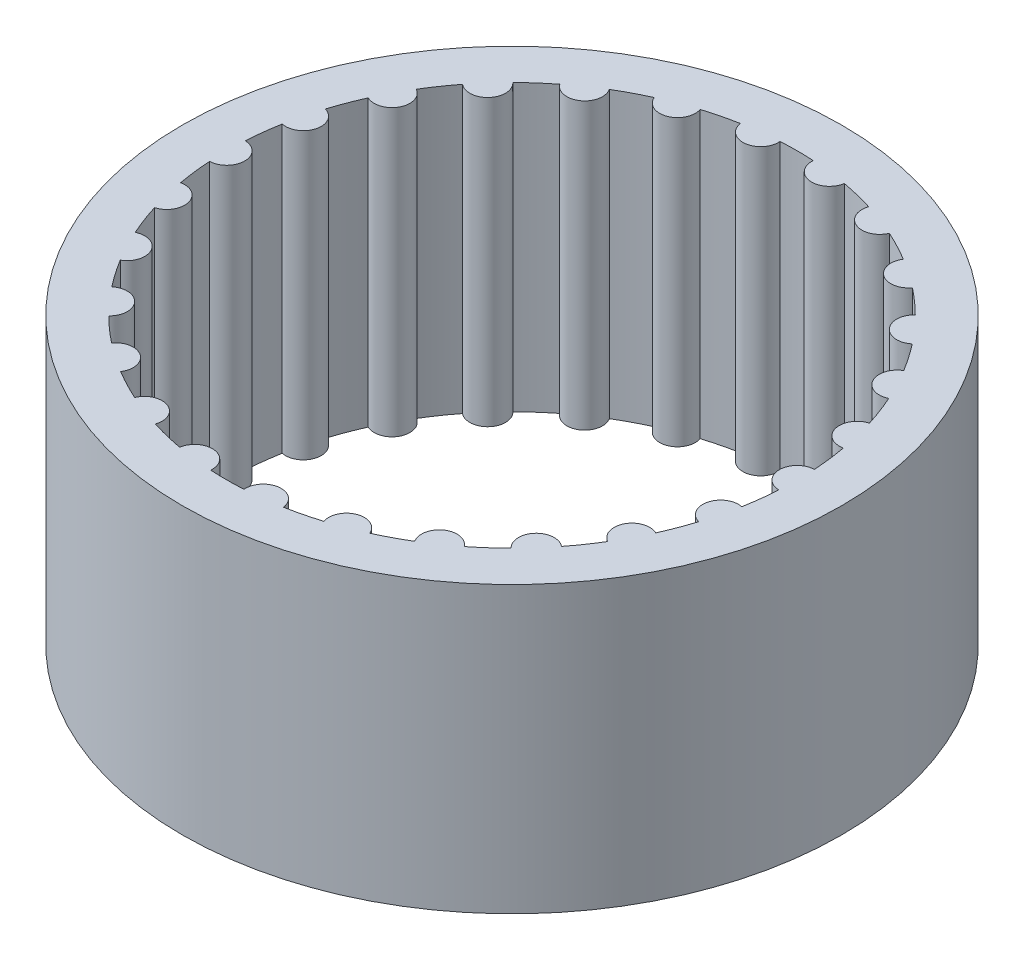
from build123d import *

# Parameters (mm, degrees)
BOSS_EXTRUDE1_DEPTH         = 8
BOSS_EXTRUDE1_DEPTH_BACK    = 8
SKETCH2_R                   = 1
BOSS_EXTRUDE1_2_DEPTH       = 8
BOSS_EXTRUDE1_2_DEPTH_BACK  = 8
BOSS_EXTRUDE1_3_DEPTH       = 8
BOSS_EXTRUDE1_3_DEPTH_BACK  = 8
BOSS_EXTRUDE1_4_DEPTH       = 8
BOSS_EXTRUDE1_4_DEPTH_BACK  = 8
BOSS_EXTRUDE1_5_DEPTH       = 8
BOSS_EXTRUDE1_5_DEPTH_BACK  = 8
BOSS_EXTRUDE1_6_DEPTH       = 8
BOSS_EXTRUDE1_6_DEPTH_BACK  = 8
BOSS_EXTRUDE1_7_DEPTH       = 8
BOSS_EXTRUDE1_7_DEPTH_BACK  = 8
BOSS_EXTRUDE1_8_DEPTH       = 8
BOSS_EXTRUDE1_8_DEPTH_BACK  = 8
BOSS_EXTRUDE1_9_DEPTH       = 8
BOSS_EXTRUDE1_9_DEPTH_BACK  = 8
BOSS_EXTRUDE1_10_DEPTH      = 8
BOSS_EXTRUDE1_10_DEPTH_BACK = 8
BOSS_EXTRUDE1_11_DEPTH      = 8
BOSS_EXTRUDE1_11_DEPTH_BACK = 8
BOSS_EXTRUDE1_12_DEPTH      = 8
BOSS_EXTRUDE1_12_DEPTH_BACK = 8
BOSS_EXTRUDE1_13_DEPTH      = 8
BOSS_EXTRUDE1_13_DEPTH_BACK = 8
BOSS_EXTRUDE1_14_DEPTH      = 8
BOSS_EXTRUDE1_14_DEPTH_BACK = 8
BOSS_EXTRUDE1_15_DEPTH      = 8
BOSS_EXTRUDE1_15_DEPTH_BACK = 8
BOSS_EXTRUDE1_16_DEPTH      = 8
BOSS_EXTRUDE1_16_DEPTH_BACK = 8
BOSS_EXTRUDE1_17_DEPTH      = 8
BOSS_EXTRUDE1_17_DEPTH_BACK = 8
BOSS_EXTRUDE1_18_DEPTH      = 8
BOSS_EXTRUDE1_18_DEPTH_BACK = 8
BOSS_EXTRUDE1_19_DEPTH      = 8
BOSS_EXTRUDE1_19_DEPTH_BACK = 8
BOSS_EXTRUDE1_20_DEPTH      = 8
BOSS_EXTRUDE1_20_DEPTH_BACK = 8
BOSS_EXTRUDE1_21_DEPTH      = 8
BOSS_EXTRUDE1_21_DEPTH_BACK = 8
BOSS_EXTRUDE1_22_DEPTH      = 8
BOSS_EXTRUDE1_22_DEPTH_BACK = 8
BOSS_EXTRUDE1_23_DEPTH      = 8
BOSS_EXTRUDE1_23_DEPTH_BACK = 8
BOSS_EXTRUDE1_24_DEPTH      = 8
BOSS_EXTRUDE1_24_DEPTH_BACK = 8
BOSS_EXTRUDE1_25_DEPTH      = 8
BOSS_EXTRUDE1_25_DEPTH_BACK = 8
BOSS_EXTRUDE1_26_DEPTH      = 8
BOSS_EXTRUDE1_26_DEPTH_BACK = 8
BOSS_EXTRUDE3_DEPTH         = 8
BOSS_EXTRUDE3_DEPTH_BACK    = 8
SKETCH5_R                   = 18.5
SKETCH5_R_2                 = 16


with BuildPart() as part:
    # Sketch2 → Boss-Extrude1 (new, two sides: drawn at the far end of the back side and taken through both)
    with BuildSketch(Plane(origin=(0, 0, 0), x_dir=(1, 0, 0), z_dir=(0, 1, 0)).offset(-BOSS_EXTRUDE1_DEPTH_BACK)):
        with Locations((15.5, 0)):
            Circle(SKETCH2_R)
    extrude(amount=BOSS_EXTRUDE1_DEPTH + BOSS_EXTRUDE1_DEPTH_BACK)



with BuildPart() as body_2:
    # Sketch2 → Boss-Extrude1 2 (new, two sides: drawn at the far end of the back side and taken through both)
    with BuildSketch(Plane(origin=(0, 0, 0), x_dir=(1, 0, 0), z_dir=(0, 1, 0)).offset(-BOSS_EXTRUDE1_2_DEPTH_BACK)):
        with Locations((15.035069079, -3.829050629)):
            Circle(SKETCH2_R)
    extrude(amount=BOSS_EXTRUDE1_2_DEPTH + BOSS_EXTRUDE1_2_DEPTH_BACK)


with BuildPart() as body_3:
    # Sketch2 → Boss-Extrude1 3 (new, two sides: drawn at the far end of the back side and taken through both)
    with BuildSketch(Plane(origin=(0, 0, 0), x_dir=(1, 0, 0), z_dir=(0, 1, 0)).offset(-BOSS_EXTRUDE1_3_DEPTH_BACK)):
        with Locations((13.66729641, -7.435570753)):
            Circle(SKETCH2_R)
    extrude(amount=BOSS_EXTRUDE1_3_DEPTH + BOSS_EXTRUDE1_3_DEPTH_BACK)


with BuildPart() as body_4:
    # Sketch2 → Boss-Extrude1 4 (new, two sides: drawn at the far end of the back side and taken through both)
    with BuildSketch(Plane(origin=(0, 0, 0), x_dir=(1, 0, 0), z_dir=(0, 1, 0)).offset(-BOSS_EXTRUDE1_4_DEPTH_BACK)):
        with Locations((11.476171971, -10.609962532)):
            Circle(SKETCH2_R)
    extrude(amount=BOSS_EXTRUDE1_4_DEPTH + BOSS_EXTRUDE1_4_DEPTH_BACK)


with BuildPart() as body_5:
    # Sketch2 → Boss-Extrude1 5 (new, two sides: drawn at the far end of the back side and taken through both)
    with BuildSketch(Plane(origin=(0, 0, 0), x_dir=(1, 0, 0), z_dir=(0, 1, 0)).offset(-BOSS_EXTRUDE1_5_DEPTH_BACK)):
        with Locations((8.589035948, -13.167741854)):
            Circle(SKETCH2_R)
    extrude(amount=BOSS_EXTRUDE1_5_DEPTH + BOSS_EXTRUDE1_5_DEPTH_BACK)


with BuildPart() as body_6:
    # Sketch2 → Boss-Extrude1 6 (new, two sides: drawn at the far end of the back side and taken through both)
    with BuildSketch(Plane(origin=(0, 0, 0), x_dir=(1, 0, 0), z_dir=(0, 1, 0)).offset(-BOSS_EXTRUDE1_6_DEPTH_BACK)):
        with Locations((5.173678193, -14.960259883)):
            Circle(SKETCH2_R)
    extrude(amount=BOSS_EXTRUDE1_6_DEPTH + BOSS_EXTRUDE1_6_DEPTH_BACK)


with BuildPart() as body_7:
    # Sketch2 → Boss-Extrude1 7 (new, two sides: drawn at the far end of the back side and taken through both)
    with BuildSketch(Plane(origin=(0, 0, 0), x_dir=(1, 0, 0), z_dir=(0, 1, 0)).offset(-BOSS_EXTRUDE1_7_DEPTH_BACK)):
        with Locations((1.428586884, -15.883341986)):
            Circle(SKETCH2_R)
    extrude(amount=BOSS_EXTRUDE1_7_DEPTH + BOSS_EXTRUDE1_7_DEPTH_BACK)


with BuildPart() as body_8:
    # Sketch2 → Boss-Extrude1 8 (new, two sides: drawn at the far end of the back side and taken through both)
    with BuildSketch(Plane(origin=(0, 0, 0), x_dir=(1, 0, 0), z_dir=(0, 1, 0)).offset(-BOSS_EXTRUDE1_8_DEPTH_BACK)):
        with Locations((-2.428586884, -15.883341986)):
            Circle(SKETCH2_R)
    extrude(amount=BOSS_EXTRUDE1_8_DEPTH + BOSS_EXTRUDE1_8_DEPTH_BACK)


with BuildPart() as body_9:
    # Sketch2 → Boss-Extrude1 9 (new, two sides: drawn at the far end of the back side and taken through both)
    with BuildSketch(Plane(origin=(0, 0, 0), x_dir=(1, 0, 0), z_dir=(0, 1, 0)).offset(-BOSS_EXTRUDE1_9_DEPTH_BACK)):
        with Locations((-6.173678193, -14.960259883)):
            Circle(SKETCH2_R)
    extrude(amount=BOSS_EXTRUDE1_9_DEPTH + BOSS_EXTRUDE1_9_DEPTH_BACK)


with BuildPart() as body_10:
    # Sketch2 → Boss-Extrude1 10 (new, two sides: drawn at the far end of the back side and taken through both)
    with BuildSketch(Plane(origin=(0, 0, 0), x_dir=(1, 0, 0), z_dir=(0, 1, 0)).offset(-BOSS_EXTRUDE1_10_DEPTH_BACK)):
        with Locations((-9.589035948, -13.167741854)):
            Circle(SKETCH2_R)
    extrude(amount=BOSS_EXTRUDE1_10_DEPTH + BOSS_EXTRUDE1_10_DEPTH_BACK)


with BuildPart() as body_11:
    # Sketch2 → Boss-Extrude1 11 (new, two sides: drawn at the far end of the back side and taken through both)
    with BuildSketch(Plane(origin=(0, 0, 0), x_dir=(1, 0, 0), z_dir=(0, 1, 0)).offset(-BOSS_EXTRUDE1_11_DEPTH_BACK)):
        with Locations((-12.476171971, -10.609962532)):
            Circle(SKETCH2_R)
    extrude(amount=BOSS_EXTRUDE1_11_DEPTH + BOSS_EXTRUDE1_11_DEPTH_BACK)


with BuildPart() as body_12:
    # Sketch2 → Boss-Extrude1 12 (new, two sides: drawn at the far end of the back side and taken through both)
    with BuildSketch(Plane(origin=(0, 0, 0), x_dir=(1, 0, 0), z_dir=(0, 1, 0)).offset(-BOSS_EXTRUDE1_12_DEPTH_BACK)):
        with Locations((-14.66729641, -7.435570753)):
            Circle(SKETCH2_R)
    extrude(amount=BOSS_EXTRUDE1_12_DEPTH + BOSS_EXTRUDE1_12_DEPTH_BACK)


with BuildPart() as body_13:
    # Sketch2 → Boss-Extrude1 13 (new, two sides: drawn at the far end of the back side and taken through both)
    with BuildSketch(Plane(origin=(0, 0, 0), x_dir=(1, 0, 0), z_dir=(0, 1, 0)).offset(-BOSS_EXTRUDE1_13_DEPTH_BACK)):
        with Locations((-16.035069079, -3.829050629)):
            Circle(SKETCH2_R)
    extrude(amount=BOSS_EXTRUDE1_13_DEPTH + BOSS_EXTRUDE1_13_DEPTH_BACK)


with BuildPart() as body_14:
    # Sketch2 → Boss-Extrude1 14 (new, two sides: drawn at the far end of the back side and taken through both)
    with BuildSketch(Plane(origin=(0, 0, 0), x_dir=(1, 0, 0), z_dir=(0, 1, 0)).offset(-BOSS_EXTRUDE1_14_DEPTH_BACK)):
        with Locations((-16.5, 0)):
            Circle(SKETCH2_R)
    extrude(amount=BOSS_EXTRUDE1_14_DEPTH + BOSS_EXTRUDE1_14_DEPTH_BACK)


with BuildPart() as body_15:
    # Sketch2 → Boss-Extrude1 15 (new, two sides: drawn at the far end of the back side and taken through both)
    with BuildSketch(Plane(origin=(0, 0, 0), x_dir=(1, 0, 0), z_dir=(0, 1, 0)).offset(-BOSS_EXTRUDE1_15_DEPTH_BACK)):
        with Locations((-16.035069079, 3.829050629)):
            Circle(SKETCH2_R)
    extrude(amount=BOSS_EXTRUDE1_15_DEPTH + BOSS_EXTRUDE1_15_DEPTH_BACK)


with BuildPart() as body_16:
    # Sketch2 → Boss-Extrude1 16 (new, two sides: drawn at the far end of the back side and taken through both)
    with BuildSketch(Plane(origin=(0, 0, 0), x_dir=(1, 0, 0), z_dir=(0, 1, 0)).offset(-BOSS_EXTRUDE1_16_DEPTH_BACK)):
        with Locations((-14.66729641, 7.435570753)):
            Circle(SKETCH2_R)
    extrude(amount=BOSS_EXTRUDE1_16_DEPTH + BOSS_EXTRUDE1_16_DEPTH_BACK)


with BuildPart() as body_17:
    # Sketch2 → Boss-Extrude1 17 (new, two sides: drawn at the far end of the back side and taken through both)
    with BuildSketch(Plane(origin=(0, 0, 0), x_dir=(1, 0, 0), z_dir=(0, 1, 0)).offset(-BOSS_EXTRUDE1_17_DEPTH_BACK)):
        with Locations((-12.476171971, 10.609962532)):
            Circle(SKETCH2_R)
    extrude(amount=BOSS_EXTRUDE1_17_DEPTH + BOSS_EXTRUDE1_17_DEPTH_BACK)


with BuildPart() as body_18:
    # Sketch2 → Boss-Extrude1 18 (new, two sides: drawn at the far end of the back side and taken through both)
    with BuildSketch(Plane(origin=(0, 0, 0), x_dir=(1, 0, 0), z_dir=(0, 1, 0)).offset(-BOSS_EXTRUDE1_18_DEPTH_BACK)):
        with Locations((-9.589035948, 13.167741854)):
            Circle(SKETCH2_R)
    extrude(amount=BOSS_EXTRUDE1_18_DEPTH + BOSS_EXTRUDE1_18_DEPTH_BACK)


with BuildPart() as body_19:
    # Sketch2 → Boss-Extrude1 19 (new, two sides: drawn at the far end of the back side and taken through both)
    with BuildSketch(Plane(origin=(0, 0, 0), x_dir=(1, 0, 0), z_dir=(0, 1, 0)).offset(-BOSS_EXTRUDE1_19_DEPTH_BACK)):
        with Locations((-6.173678193, 14.960259883)):
            Circle(SKETCH2_R)
    extrude(amount=BOSS_EXTRUDE1_19_DEPTH + BOSS_EXTRUDE1_19_DEPTH_BACK)


with BuildPart() as body_20:
    # Sketch2 → Boss-Extrude1 20 (new, two sides: drawn at the far end of the back side and taken through both)
    with BuildSketch(Plane(origin=(0, 0, 0), x_dir=(1, 0, 0), z_dir=(0, 1, 0)).offset(-BOSS_EXTRUDE1_20_DEPTH_BACK)):
        with Locations((-2.428586884, 15.883341986)):
            Circle(SKETCH2_R)
    extrude(amount=BOSS_EXTRUDE1_20_DEPTH + BOSS_EXTRUDE1_20_DEPTH_BACK)


with BuildPart() as body_21:
    # Sketch2 → Boss-Extrude1 21 (new, two sides: drawn at the far end of the back side and taken through both)
    with BuildSketch(Plane(origin=(0, 0, 0), x_dir=(1, 0, 0), z_dir=(0, 1, 0)).offset(-BOSS_EXTRUDE1_21_DEPTH_BACK)):
        with Locations((1.428586884, 15.883341986)):
            Circle(SKETCH2_R)
    extrude(amount=BOSS_EXTRUDE1_21_DEPTH + BOSS_EXTRUDE1_21_DEPTH_BACK)


with BuildPart() as body_22:
    # Sketch2 → Boss-Extrude1 22 (new, two sides: drawn at the far end of the back side and taken through both)
    with BuildSketch(Plane(origin=(0, 0, 0), x_dir=(1, 0, 0), z_dir=(0, 1, 0)).offset(-BOSS_EXTRUDE1_22_DEPTH_BACK)):
        with Locations((5.173678193, 14.960259883)):
            Circle(SKETCH2_R)
    extrude(amount=BOSS_EXTRUDE1_22_DEPTH + BOSS_EXTRUDE1_22_DEPTH_BACK)


with BuildPart() as body_23:
    # Sketch2 → Boss-Extrude1 23 (new, two sides: drawn at the far end of the back side and taken through both)
    with BuildSketch(Plane(origin=(0, 0, 0), x_dir=(1, 0, 0), z_dir=(0, 1, 0)).offset(-BOSS_EXTRUDE1_23_DEPTH_BACK)):
        with Locations((8.589035948, 13.167741854)):
            Circle(SKETCH2_R)
    extrude(amount=BOSS_EXTRUDE1_23_DEPTH + BOSS_EXTRUDE1_23_DEPTH_BACK)


with BuildPart() as body_24:
    # Sketch2 → Boss-Extrude1 24 (new, two sides: drawn at the far end of the back side and taken through both)
    with BuildSketch(Plane(origin=(0, 0, 0), x_dir=(1, 0, 0), z_dir=(0, 1, 0)).offset(-BOSS_EXTRUDE1_24_DEPTH_BACK)):
        with Locations((11.476171971, 10.609962532)):
            Circle(SKETCH2_R)
    extrude(amount=BOSS_EXTRUDE1_24_DEPTH + BOSS_EXTRUDE1_24_DEPTH_BACK)


with BuildPart() as body_25:
    # Sketch2 → Boss-Extrude1 25 (new, two sides: drawn at the far end of the back side and taken through both)
    with BuildSketch(Plane(origin=(0, 0, 0), x_dir=(1, 0, 0), z_dir=(0, 1, 0)).offset(-BOSS_EXTRUDE1_25_DEPTH_BACK)):
        with Locations((13.66729641, 7.435570753)):
            Circle(SKETCH2_R)
    extrude(amount=BOSS_EXTRUDE1_25_DEPTH + BOSS_EXTRUDE1_25_DEPTH_BACK)


with BuildPart() as body_26:
    # Sketch2 → Boss-Extrude1 26 (new, two sides: drawn at the far end of the back side and taken through both)
    with BuildSketch(Plane(origin=(0, 0, 0), x_dir=(1, 0, 0), z_dir=(0, 1, 0)).offset(-BOSS_EXTRUDE1_26_DEPTH_BACK)):
        with Locations((15.035069079, 3.829050629)):
            Circle(SKETCH2_R)
    extrude(amount=BOSS_EXTRUDE1_26_DEPTH + BOSS_EXTRUDE1_26_DEPTH_BACK)


with BuildPart() as part_1:
    add(part.part)

    add(body_2.part)  # Boss-Extrude3 merges body 2

    add(body_3.part)  # Boss-Extrude3 merges body 3

    add(body_4.part)  # Boss-Extrude3 merges body 4

    add(body_5.part)  # Boss-Extrude3 merges body 5

    add(body_6.part)  # Boss-Extrude3 merges body 6

    add(body_7.part)  # Boss-Extrude3 merges body 7

    add(body_8.part)  # Boss-Extrude3 merges body 8

    add(body_9.part)  # Boss-Extrude3 merges body 9

    add(body_10.part)  # Boss-Extrude3 merges body 10

    add(body_11.part)  # Boss-Extrude3 merges body 11

    add(body_12.part)  # Boss-Extrude3 merges body 12

    add(body_13.part)  # Boss-Extrude3 merges body 13

    add(body_14.part)  # Boss-Extrude3 merges body 14

    add(body_15.part)  # Boss-Extrude3 merges body 15

    add(body_16.part)  # Boss-Extrude3 merges body 16

    add(body_17.part)  # Boss-Extrude3 merges body 17

    add(body_18.part)  # Boss-Extrude3 merges body 18

    add(body_19.part)  # Boss-Extrude3 merges body 19

    add(body_20.part)  # Boss-Extrude3 merges body 20

    add(body_21.part)  # Boss-Extrude3 merges body 21

    add(body_22.part)  # Boss-Extrude3 merges body 22

    add(body_23.part)  # Boss-Extrude3 merges body 23

    add(body_24.part)  # Boss-Extrude3 merges body 24

    add(body_25.part)  # Boss-Extrude3 merges body 25

    add(body_26.part)  # Boss-Extrude3 merges body 26
    # Sketch5 → Boss-Extrude3 (add, two sides: drawn at the far end of the back side and taken through both)
    with BuildSketch(Plane(origin=(0, 0, 0), x_dir=(1, 0, 0), z_dir=(0, 1, 0)).offset(-BOSS_EXTRUDE3_DEPTH_BACK)):
        with Locations((-0.5, 0)):
            Circle(SKETCH5_R)
        with Locations((-0.5, 0)):
            Circle(SKETCH5_R_2, mode=Mode.SUBTRACT)
    extrude(amount=BOSS_EXTRUDE3_DEPTH + BOSS_EXTRUDE3_DEPTH_BACK)


solid = part_1.part
